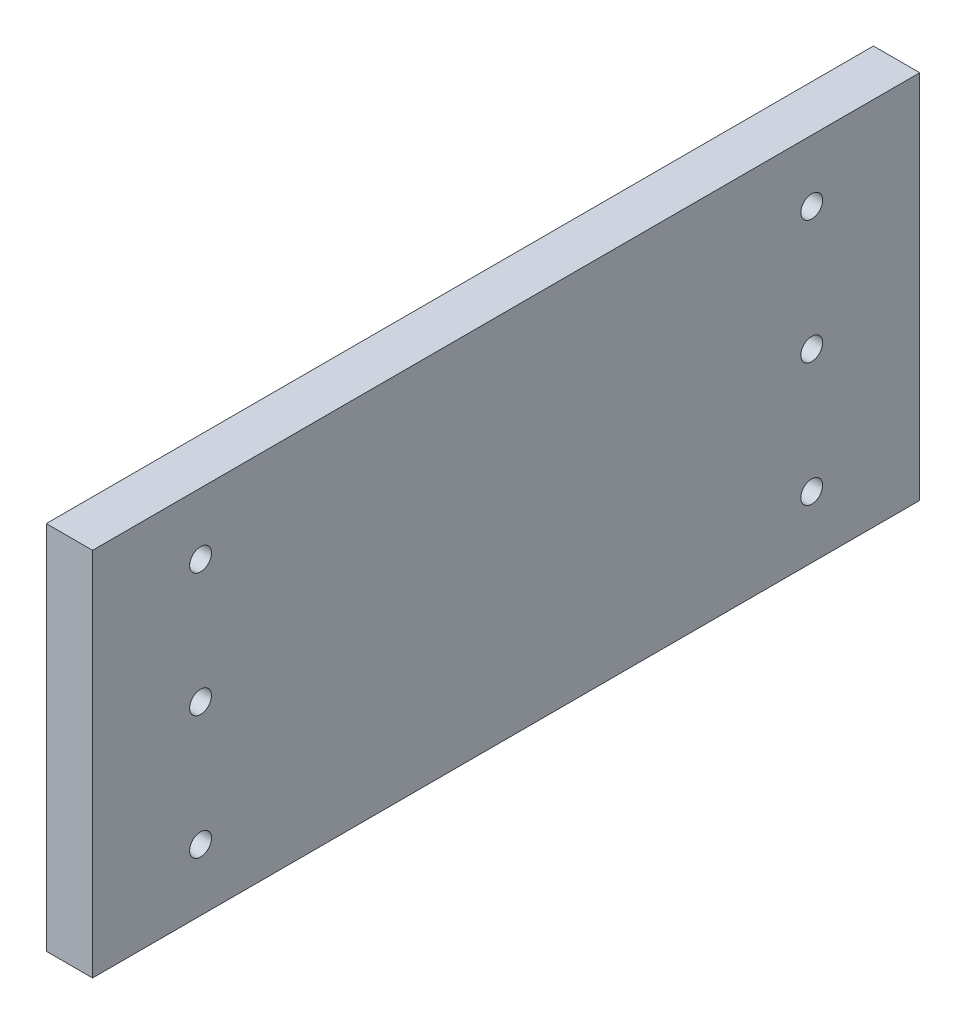
from build123d import *

# Parameters (mm, degrees)
SKETCH1_W             = 9.525
SKETCH1_H             = 76.2
BOSS_EXTRUDE1_DEPTH   = 170.18
F_8_CLEARANCE_HOLE1_D = 4.4958


with BuildPart() as part:
    # Sketch1 → Boss-Extrude1 (new body)
    with BuildSketch(Plane.XY):
        Rectangle(SKETCH1_W, SKETCH1_H)
    extrude(amount=BOSS_EXTRUDE1_DEPTH)

    # #8 Clearance Hole1 (through all)
    with Locations(Plane(origin=(4.7625, 0, 0), x_dir=(0, 0, -1), z_dir=(1, 0, 0))):
        with Locations((-147.955, 25.4), (-147.955, 0), (-147.955, -25.4), (-22.225, 25.4), (-22.225, 0), (-22.225, -25.4)):
            Hole(F_8_CLEARANCE_HOLE1_D / 2)


solid = part.part
